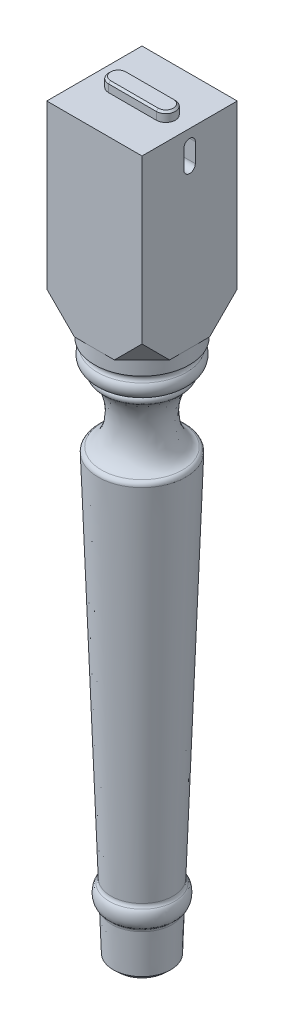
from build123d import *

# Parameters (mm, degrees)
ESQUISSE2_W             = 100
ESQUISSE2_H             = 100
BOSS_EXTRU_1_DEPTH      = 200
CHANFREIN1_SIZE         = 5
CHANFREIN1_SIZE2        = 5.181649332
CONG_2_R                = 5
CONG_4_R                = 5
CONG_5_R                = 5
BOSS_EXTRU_2_DEPTH      = 10
CHANFREIN2_SIZE         = 2
ENL_V_MAT_EXTRU_1_DEPTH = 15
ENL_V_MAT_EXTRU_2_DEPTH = 15
CHANFREIN3_START        = -293.871287018
CHANFREIN3_DEPTH        = 16.743157807
CHANFREIN4_START        = -293.871287018
CHANFREIN4_DEPTH        = 16.743157807
CHANFREIN5_START        = 277.128129211
CHANFREIN5_DEPTH        = 16.743157807
CHANFREIN6_START        = 277.128129211
CHANFREIN6_DEPTH        = 16.743157807


with BuildPart() as part:
    # Esquisse1 → Révolution1 (revolve)
    with BuildSketch(Plane.XY, mode=Mode.PRIVATE) as r_volution1_sk:
        with BuildLine():
            Line((0, 0), (0, 580))
            Line((0, 580), (50, 580))
            Line((50, 580), (49.902202714, 565))
            Line((49.902202714, 565), (39.100313465, 560))
            ThreePointArc((39.100313465, 560), (49.100313465, 550), (39.100313465, 540))
            Line((39.100313465, 540), (48.448275862, 535))
            add(Edge.make_bspline(
                [(48.448275862, 535), (28.460155875, 535.689245517), (27.253259323, 500.689245517), (26.046362772, 465.689245517), (46.034482759, 465)],
                knots=[3.141592654, 3.141592654, 3.141592654, 4.71238898, 4.71238898, 6.283185307, 6.283185307, 6.283185307], degree=2, weights=[1, 0.707106781, 1, 0.707106781, 1]))
            Line((46.034482759, 465), (32.413793103, 70))
            add(Edge.make_bspline(
                [(31.724137931, 50), (36.724137931, 49.827586207), (37.068965517, 59.827586207), (37.413793103, 69.827586207), (32.413793103, 70)],
                knots=[3.141592654, 3.141592654, 3.141592654, 4.71238898, 4.71238898, 6.283185307, 6.283185307, 6.283185307], degree=2, weights=[1, 0.707106781, 1, 0.707106781, 1]))
            Line((31.724137931, 50), (30, 0))
            Line((30, 0), (0, 0))
        make_face()
    revolve(r_volution1_sk.sketch.rotate(Axis((0, 0, 0), (0, 1, 0)), 90), axis=Axis((0, 0, 0), (0, 1, 0)))

    # Esquisse2 → Boss.-Extru.1 (add)
    with BuildSketch(Plane(origin=(0, 580, 0), x_dir=(1, 0, 0), z_dir=(0, 1, 0))):
        Rectangle(ESQUISSE2_W, ESQUISSE2_H)
    extrude(amount=BOSS_EXTRU_1_DEPTH)

    # Chanfrein1
    chanfrein1_edges = [part.edges().sort_by_distance(p)[0] for p in [
        (0, 0, 30),
    ]]
    chanfrein1_side = [part.faces().sort_by_distance(p)[0] for p in [
        (0, 25, 30.862068966),
    ]]
    chamfer(chanfrein1_edges, length=CHANFREIN1_SIZE, length2=CHANFREIN1_SIZE2, reference=chanfrein1_side[0])

    # Congé2
    cong_2_edges = [part.edges().sort_by_distance(p)[0] for p in [
        (0, 70, 32.413793103),
        (0, 50, 31.724137931),
    ]]
    fillet(cong_2_edges, radius=CONG_2_R)

    # Congé3: read off the stored shape, not the designer's step
    # Congé3 outline → Congé3 (revolve, cut)
    with BuildSketch(Plane.XY):
        with BuildLine():
            ThreePointArc((39.100313465, 540), (41.502931935, 536.034040873), (39.613670138, 531.799410173))
            Line((39.613670138, 531.799410173), (48.448275862, 531.799410173))
            Line((48.448275862, 531.799410173), (48.448275862, 535))
            Line((48.448275862, 535), (39.100313465, 540))
        make_face()
    revolve(axis=Axis((0, 0, 0), (0, 1, 0)), mode=Mode.SUBTRACT)

    # Congé4
    cong_4_edges = [part.edges().sort_by_distance(p)[0] for p in [
        (0, 465, 46.034482759),
    ]]
    fillet(cong_4_edges, radius=CONG_4_R)

    # Congé5
    cong_5_edges = [part.edges().sort_by_distance(p)[0] for p in [
        (0, 560, 39.100313465),
    ]]
    fillet(cong_5_edges, radius=CONG_5_R)

    # Esquisse3 → Boss.-Extru.2 (add)
    with BuildSketch(Plane(origin=(0, 780, 0), x_dir=(1, 0, 0), z_dir=(0, 1, 0))):
        with BuildLine():
            Line((-25, 10), (25, 10))
            ThreePointArc((25, 10), (35, 0), (25, -10))
            Line((25, -10), (-25, -10))
            ThreePointArc((-25, -10), (-35, 0), (-25, 10))
        make_face()
    extrude(amount=BOSS_EXTRU_2_DEPTH)

    # Chanfrein2
    chanfrein2_edges = [part.edges().sort_by_distance(p)[0] for p in [
        (-35, 790, 0),
        (0, 790, 10),
        (35, 790, 0),
        (0, 790, -10),
    ]]
    chamfer(chanfrein2_edges, length=CHANFREIN2_SIZE)

    # Esquisse5 → Enlèv. mat.-Extru.1 (cut)
    with BuildSketch(Plane(origin=(50, 0, 0), x_dir=(0, 0, -1), z_dir=(1, 0, 0))):
        with BuildLine():
            Line((6, 765), (6, 745))
            ThreePointArc((6, 745), (0, 739), (-6, 745))
            Line((-6, 745), (-6, 765))
            ThreePointArc((-6, 765), (0, 771), (6, 765))
        make_face()
    extrude(amount=-ENL_V_MAT_EXTRU_1_DEPTH, mode=Mode.SUBTRACT)

    # Esquisse6 → Enlèv. mat.-Extru.2 (cut)
    with BuildSketch(Plane(origin=(0, 0, -50), x_dir=(-1, 0, 0), z_dir=(0, 0, -1))):
        with BuildLine():
            Line((6, 765), (6, 745))
            ThreePointArc((6, 745), (0, 739), (-6, 745))
            Line((-6, 745), (-6, 765))
            ThreePointArc((-6, 765), (0, 771), (6, 765))
        make_face()
    extrude(amount=-ENL_V_MAT_EXTRU_2_DEPTH, mode=Mode.SUBTRACT)

    # Chanfrein3: read off the stored shape, not the designer's step
    # Chanfrein3 outline → Chanfrein3 (cut)
    with BuildSketch(Plane(origin=(0, 0, 0), x_dir=(0.8164965809277258, 0.4082482904638629, 0.4082482904638636), z_dir=(0.5773502691896261, -0.5773502691896252, -0.5773502691896261)).offset(CHANFREIN3_START)):
        Polygon((233.518022145, -445.477272148), (269.035623416, -465.983368802), (269.035623416, -424.971175493), align=None)
    extrude(amount=CHANFREIN3_DEPTH, mode=Mode.SUBTRACT)

    # Chanfrein4: read off the stored shape, not the designer's step
    # Chanfrein4 outline → Chanfrein4 (cut)
    with BuildSketch(Plane(origin=(0, 0, 0), x_dir=(0.8164965809277258, 0.4082482904638629, -0.4082482904638636), z_dir=(0.5773502691896261, -0.5773502691896252, 0.5773502691896261)).offset(CHANFREIN4_START)):
        Polygon((269.035623416, 424.971175493), (269.035623416, 465.983368802), (233.518022145, 445.477272148), align=None)
    extrude(amount=CHANFREIN4_DEPTH, mode=Mode.SUBTRACT)

    # Chanfrein5: read off the stored shape, not the designer's step
    # Chanfrein5 outline → Chanfrein5 (cut)
    with BuildSketch(Plane(origin=(0, 0, 0), x_dir=(0.8164965809277258, -0.408248290463863, 0.4082482904638638), z_dir=(0.5773502691896262, 0.5773502691896252, -0.5773502691896262)).offset(CHANFREIN5_START)):
        Polygon((-269.035623416, -424.971175493), (-269.035623416, -465.983368802), (-233.518022145, -445.477272148), align=None)
    extrude(amount=CHANFREIN5_DEPTH, mode=Mode.SUBTRACT)

    # Chanfrein6: read off the stored shape, not the designer's step
    # Chanfrein6 outline → Chanfrein6 (cut)
    with BuildSketch(Plane(origin=(0, 0, 0), x_dir=(0.8164965809277258, -0.408248290463863, -0.4082482904638638), z_dir=(0.5773502691896262, 0.5773502691896252, 0.5773502691896262)).offset(CHANFREIN6_START)):
        Polygon((-269.035623416, 465.983368802), (-269.035623416, 424.971175493), (-233.518022145, 445.477272148), align=None)
    extrude(amount=CHANFREIN6_DEPTH, mode=Mode.SUBTRACT)


solid = part.part
